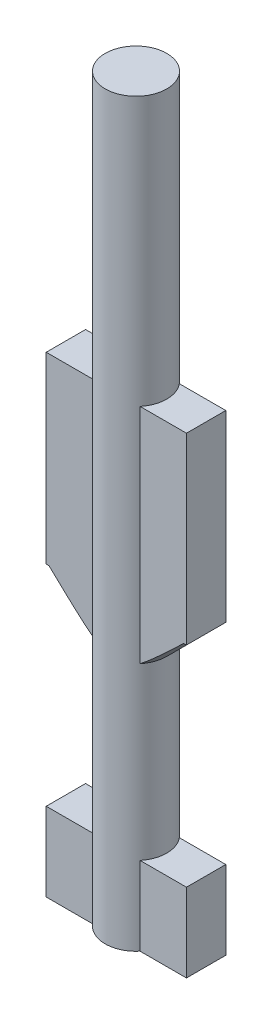
from build123d import *
from build123d.topology import SkipClean

# Parameters (mm, degrees)
SKETCH1_R           = 2.35
BOSS_EXTRUDE1_DEPTH = 6
SKETCH2_R           = 2.35
BOSS_EXTRUDE2_DEPTH = 16
BOSS_EXTRUDE3_START = 22
SKETCH1_2_R         = 2.35
BOSS_EXTRUDE3_DEPTH = 14
BOSS_EXTRUDE4_START = 30
SKETCH2_2_R         = 2.35
BOSS_EXTRUDE4_DEPTH = 20.5
CHAMFER1_SIZE       = 3


with BuildPart() as part:
    # Sketch1 → Boss-Extrude1 (new body)
    with BuildSketch(Plane(origin=(0, 0, 0), x_dir=(1, 0, 0), z_dir=(0, 1, 0))):
        with BuildLine():
            Line((-5.35, -1.5), (-1.809005252, -1.5))
            ThreePointArc((-1.809005252, -1.5), (-2.35, 0), (-1.809005252, 1.5))
            Line((-1.809005252, 1.5), (-5.35, 1.5))
            Line((-5.35, 1.5), (-5.35, -1.5))
        make_face()
        Circle(SKETCH1_R)
        with BuildLine():
            ThreePointArc((2.35, 0), (2.210617826, -0.797288423), (1.809005252, -1.5))
            Line((1.809005252, -1.5), (5.35, -1.5))
            Line((5.35, -1.5), (5.35, 1.5))
            Line((5.35, 1.5), (1.809005252, 1.5))
            ThreePointArc((1.809005252, 1.5), (2.210617826, 0.797288423), (2.35, 0))
        make_face()
    extrude(amount=BOSS_EXTRUDE1_DEPTH)

    # Sketch2 → Boss-Extrude2 (add)
    with BuildSketch(Plane(origin=(0, 6, 0), x_dir=(1, 0, 0), z_dir=(0, 1, 0))):
        with Locations(Location((0, 0, 0), (0, 0, 39.665012908))):
            Circle(SKETCH2_R)
    extrude(amount=BOSS_EXTRUDE2_DEPTH)

    # Sketch1<2> → Boss-Extrude3 (add)
    with BuildSketch(Plane(origin=(0, 0, 0), x_dir=(1, 0, 0), z_dir=(0, 1, 0)).offset(BOSS_EXTRUDE3_START)):
        with BuildLine():
            Line((-5.35, -1.5), (-1.809005252, -1.5))
            ThreePointArc((-1.809005252, -1.5), (-2.35, 0), (-1.809005252, 1.5))
            Line((-1.809005252, 1.5), (-5.35, 1.5))
            Line((-5.35, 1.5), (-5.35, -1.5))
        make_face()
        with Locations(Location((0, 0, 0), (0, 0, 39.665012908))):
            Circle(SKETCH1_2_R)
        with BuildLine():
            ThreePointArc((2.35, 0), (2.210617826, -0.797288423), (1.809005252, -1.5))
            Line((1.809005252, -1.5), (5.35, -1.5))
            Line((5.35, -1.5), (5.35, 1.5))
            Line((5.35, 1.5), (1.809005252, 1.5))
            ThreePointArc((1.809005252, 1.5), (2.210617826, 0.797288423), (2.35, 0))
        make_face()
    extrude(amount=BOSS_EXTRUDE3_DEPTH)

    # Sketch2<2> → Boss-Extrude4 (add)
    with SkipClean():  # the faces are left unmerged after this step: merging them gives an invalid solid
        with BuildSketch(Plane(origin=(0, 6, 0), x_dir=(1, 0, 0), z_dir=(0, 1, 0)).offset(BOSS_EXTRUDE4_START)):
            with Locations(Location((0, 0, 0), (0, 0, 39.665012908))):
                Circle(SKETCH2_2_R)
        extrude(amount=BOSS_EXTRUDE4_DEPTH)

    # Chamfer1
    # the kernel refuses this chamfer: 3 mm, written as the material it adds along each edge
    with BuildSketch(Plane(origin=(0, 22, 0), x_dir=(-0.9999950652018471, 0, 0.003141587489430323), z_dir=(-0.003141587489430323, 0, -0.9999950652018471))) as chamfer1_piece_1_section:
        Polygon((2.35, -CHAMFER1_SIZE), (2.35 + CHAMFER1_SIZE, 0), (2.35, 0), align=None)
    chamfer1_piece_1 = revolve(axis=Axis((0, 22, 0), (0, 1, 0)), revolution_arc=359.64, mode=Mode.PRIVATE)
    chamfer1_piece_1 = split(chamfer1_piece_1, bisect_by=Plane(origin=(-3.19448265, 21.00212183, 1.5), z_dir=(0, 0, -1)), keep=Keep.TOP, mode=Mode.PRIVATE)
    chamfer1_piece_1 = split(chamfer1_piece_1, bisect_by=Plane(origin=(-3.19448265, 21.00212183, -1.5), z_dir=(0, 0, 1)), keep=Keep.TOP, mode=Mode.PRIVATE)
    chamfer1_piece_1 = split(chamfer1_piece_1, bisect_by=Plane(origin=(5.35, 21.00212183, 0.771950274), z_dir=(-1, 0, 0)), keep=Keep.TOP, mode=Mode.PRIVATE)
    add(chamfer1_piece_1)
    with BuildSketch(Plane(origin=(0, 22, 0), x_dir=(0.9999950652018581, 0, -0.0031415874858800653), z_dir=(0.0031415874858800653, 0, 0.9999950652018581))) as chamfer1_piece_2_section:
        Polygon((2.35, -CHAMFER1_SIZE), (2.35 + CHAMFER1_SIZE, 0), (2.35, 0), align=None)
    chamfer1_piece_2 = revolve(axis=Axis((0, 22, 0), (0, 1, 0)), revolution_arc=359.64, mode=Mode.PRIVATE)
    chamfer1_piece_2 = split(chamfer1_piece_2, bisect_by=Plane(origin=(3.19448265, 21.00212183, 1.5), z_dir=(0, 0, -1)), keep=Keep.TOP, mode=Mode.PRIVATE)
    chamfer1_piece_2 = split(chamfer1_piece_2, bisect_by=Plane(origin=(3.19448265, 21.00212183, -1.5), z_dir=(0, 0, 1)), keep=Keep.TOP, mode=Mode.PRIVATE)
    chamfer1_piece_2 = split(chamfer1_piece_2, bisect_by=Plane(origin=(-5.35, 21.00212183, -0.771950274), z_dir=(1, 0, 0)), keep=Keep.TOP, mode=Mode.PRIVATE)
    add(chamfer1_piece_2)


solid = part.part
